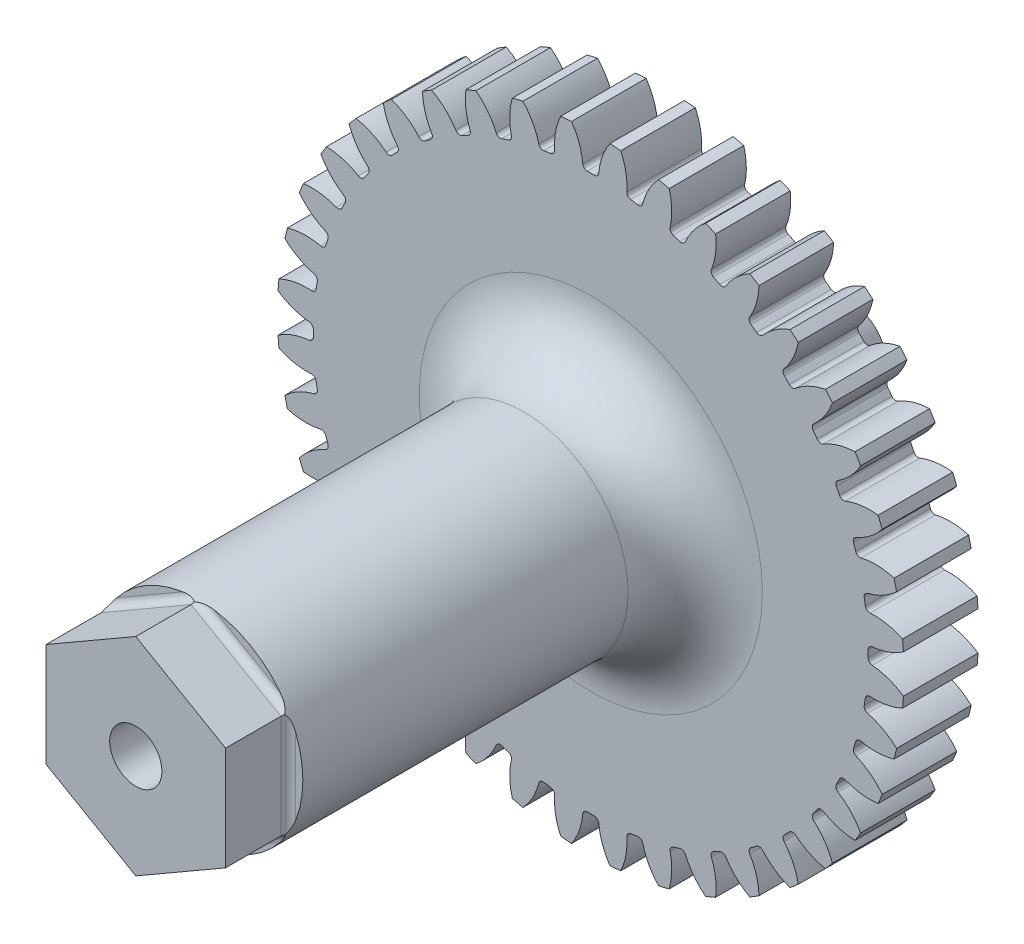
from build123d import *

# Parameters (mm, degrees)
SKETCH1_R                = 21
BOSS_EXTRUDE1_DEPTH      = 2.5
CUT_EXTRUDE1_DEPTH       = 31.116440693
FILLET1_R                = 0.3
CIRPATTERN1_COUNT        = 40
FILLET1_OF_CIRPATTERN1_R = 0.3
SKETCH4_R                = 7
WHEELSHAFT_DEPTH         = 26.3
SKETCH5_R                = 2.8
BOSS_EXTRUDE3_DEPTH      = 12.43
FILLET3_R                = 7.4
CHAMFER1_SIZE            = 1.5
CHAMFER1_SIZE2           = 0.401923789
FILLET4_R                = 4.5
BOSS_EXTRUDE4_DEPTH      = 4.2
SKETCH7_R                = 1.75
CUT_EXTRUDE2_DEPTH       = 7
FILLET5_R                = 0.5


with BuildPart() as part:
    # Sketch1 → Boss-Extrude1 (new, symmetric)
    with BuildSketch(Plane.XY):
        Circle(SKETCH1_R)
    extrude(amount=BOSS_EXTRUDE1_DEPTH, both=True)

    # Sketch3 → Cut-Extrude1 (cut, symmetric)
    with BuildSketch(Plane.XY.offset(2.5)):
        with BuildLine():
            ThreePointArc((-2.139593078, 21.895710572), (-0.970695217, 20.420263648), (-0.519675362, 18.592738839))
            ThreePointArc((-0.519675362, 18.592738839), (0, 18.6), (0.519675362, 18.592738839))
            ThreePointArc((0.519675362, 18.592738839), (0.970695217, 20.420263648), (2.139593078, 21.895710572))
            ThreePointArc((2.139593078, 21.895710572), (0, 22), (-2.139593078, 21.895710572))
        make_face()
    cut_extrude1 = extrude(amount=CUT_EXTRUDE1_DEPTH, both=True, mode=Mode.SUBTRACT)

    # Fillet1
    fillet1_edges = [part.edges().sort_by_distance(p)[0] for p in [
        (-0.519675362, 18.592738839, 0),
        (0.519675362, 18.592738839, 0),
    ]]
    fillet(fillet1_edges, radius=FILLET1_R)

    # CirPattern1: Cut-Extrude1 ×40 about axis
    cirpattern1_axis = Axis((0, 0, 0), (0, 0, 1))
    for i in range(1, CIRPATTERN1_COUNT):
        add(cut_extrude1.rotate(cirpattern1_axis, i * 360 / CIRPATTERN1_COUNT), mode=Mode.SUBTRACT)

    # Fillet1 of CirPattern1
    fillet1_of_cirpattern1_edges = [part.edges().sort_by_distance(p)[0] for p in [
        (-3.42182245, 18.282536233, 0),
        (-2.395267858, 18.445126508, 0),
        (-6.239712913, 17.52215691, 0),
        (-5.251231633, 17.843333947, 0),
        (-8.903960935, 16.33032393, 0),
        (-7.977892658, 16.802179285, 0),
        (-11.348963889, 14.736384178, 0),
        (-10.508111489, 15.347299206, 0),
        (-13.514517686, 12.779585741, 0),
        (-12.779585741, 13.514517686, 0),
        (-15.347299206, 10.508111489, 0),
        (-14.736384178, 11.348963889, 0),
        (-16.802179285, 7.977892658, 0),
        (-16.33032393, 8.903960935, 0),
        (-17.843333947, 5.251231633, 0),
        (-17.52215691, 6.239712913, 0),
        (-18.445126508, 2.395267858, 0),
        (-18.282536233, 3.42182245, 0),
        (-18.592738839, -0.519675362, 0),
        (-18.592738839, 0.519675362, 0),
        (-18.282536233, -3.42182245, 0),
        (-18.445126508, -2.395267858, 0),
        (-17.52215691, -6.239712913, 0),
        (-17.843333947, -5.251231633, 0),
        (-16.33032393, -8.903960935, 0),
        (-16.802179285, -7.977892658, 0),
        (-14.736384178, -11.348963889, 0),
        (-15.347299206, -10.508111489, 0),
        (-12.779585741, -13.514517686, 0),
        (-13.514517686, -12.779585741, 0),
        (-10.508111489, -15.347299206, 0),
        (-11.348963889, -14.736384178, 0),
        (-7.977892658, -16.802179285, 0),
        (-8.903960935, -16.33032393, 0),
        (-5.251231633, -17.843333947, 0),
        (-6.239712913, -17.52215691, 0),
        (-2.395267858, -18.445126508, 0),
        (-3.42182245, -18.282536233, 0),
        (0.519675362, -18.592738839, 0),
        (-0.519675362, -18.592738839, 0),
        (3.42182245, -18.282536233, 0),
        (2.395267858, -18.445126508, 0),
        (6.239712913, -17.52215691, 0),
        (5.251231633, -17.843333947, 0),
        (8.903960935, -16.33032393, 0),
        (7.977892658, -16.802179285, 0),
        (11.348963889, -14.736384178, 0),
        (10.508111489, -15.347299206, 0),
        (13.514517686, -12.779585741, 0),
        (12.779585741, -13.514517686, 0),
        (15.347299206, -10.508111489, 0),
        (14.736384178, -11.348963889, 0),
        (16.802179285, -7.977892658, 0),
        (16.33032393, -8.903960935, 0),
        (17.843333947, -5.251231633, 0),
        (17.52215691, -6.239712913, 0),
        (18.445126508, -2.395267858, 0),
        (18.282536233, -3.42182245, 0),
        (18.592738839, 0.519675362, 0),
        (18.592738839, -0.519675362, 0),
        (18.282536233, 3.42182245, 0),
        (18.445126508, 2.395267858, 0),
        (17.52215691, 6.239712913, 0),
        (17.843333947, 5.251231633, 0),
        (16.33032393, 8.903960935, 0),
        (16.802179285, 7.977892658, 0),
        (14.736384178, 11.348963889, 0),
        (15.347299206, 10.508111489, 0),
        (12.779585741, 13.514517686, 0),
        (13.514517686, 12.779585741, 0),
        (10.508111489, 15.347299206, 0),
        (11.348963889, 14.736384178, 0),
        (7.977892658, 16.802179285, 0),
        (8.903960935, 16.33032393, 0),
        (5.251231633, 17.843333947, 0),
        (6.239712913, 17.52215691, 0),
        (2.395267858, 18.445126508, 0),
        (3.42182245, 18.282536233, 0),
    ]]
    fillet(fillet1_of_cirpattern1_edges, radius=FILLET1_OF_CIRPATTERN1_R)

    # Sketch4 → Wheelshaft (add)
    with BuildSketch(Plane.XY.offset(2.5)):
        Circle(SKETCH4_R)
    extrude(amount=WHEELSHAFT_DEPTH)

    # Sketch5 → Boss-Extrude3 (add)
    with BuildSketch(Plane(origin=(0, 0, -2.5), x_dir=(-1, 0, 0), z_dir=(0, 0, -1))):
        with Locations(Location((0, 0, 0), (0, 0, 180))):
            Circle(SKETCH5_R)
    extrude(amount=BOSS_EXTRUDE3_DEPTH)

    # Fillet3
    fillet3_edges = [part.edges().sort_by_distance(p)[0] for p in [
        (-2.8, 0, -2.5),
    ]]
    fillet(fillet3_edges, radius=FILLET3_R)

    # Chamfer1
    chamfer1_edges = [part.edges().sort_by_distance(p)[0] for p in [
        (-2.8, 0, -14.93),
    ]]
    chamfer1_side = [part.faces().sort_by_distance(p)[0] for p in [
        (-2.8, 0, -12.415),
    ]]
    chamfer(chamfer1_edges, length=CHAMFER1_SIZE, length2=CHAMFER1_SIZE2, reference=chamfer1_side[0])

    # Fillet4
    fillet4_edges = [part.edges().sort_by_distance(p)[0] for p in [
        (-7, 0, 2.5),
    ]]
    fillet(fillet4_edges, radius=FILLET4_R)

    # Sketch6 → Boss-Extrude4 (add)
    with BuildSketch(Plane.XY.offset(28.8)):
        Polygon((0, 6.95), (-6.018876556, 3.475), (-6.018876556, -3.475), (0, -6.95), (6.018876556, -3.475), (6.018876556, 3.475), align=None)
    extrude(amount=BOSS_EXTRUDE4_DEPTH)

    # Sketch7 → Cut-Extrude2 (cut)
    with BuildSketch(Plane.XY.offset(33)):
        Circle(SKETCH7_R)
    extrude(amount=-CUT_EXTRUDE2_DEPTH, mode=Mode.SUBTRACT)

    # Fillet5
    # the kernel refuses this fillet: 0.5 mm, written as the material it adds along each edge
    with BuildSketch(Plane(origin=(7.101408311, 2.85, 28.8), x_dir=(0.4999999999999999, 0.8660254037844388, 0), z_dir=(-0.8660254037844387, 0.49999999999999983, 0))) as fillet5_piece_1_section:
        with BuildLine():
            CenterArc((FILLET5_R, -FILLET5_R), FILLET5_R, 90, 90)
            Line((0, -FILLET5_R), (0, 0))
            Line((0, 0), (FILLET5_R, 0))
        make_face()
    fillet5_piece_1 = extrude(amount=9.45, mode=Mode.PRIVATE)
    fillet5_piece_1 = fillet5_piece_1 & Plane(origin=(0, 0, 28.916287623), x_dir=(1, 0, 0), z_dir=(0, 0, -1)) * Cylinder(7, 21, mode=Mode.PRIVATE)
    fillet5_piece_1 = split(fillet5_piece_1, bisect_by=Plane(origin=(1.585318022, 7.865283786, 28.916287623), z_dir=(0.4999999999999999, -0.8660254037844387, 0)), keep=Keep.TOP, mode=Mode.PRIVATE)
    fillet5_piece_1 = split(fillet5_piece_1, bisect_by=Plane(origin=(6.018876556, 5.305567502, 28.916287623), z_dir=(-1, 0, 0)), keep=Keep.TOP, mode=Mode.PRIVATE)
    add(fillet5_piece_1)
    with BuildSketch(Plane(origin=(1.082531755, 7.575, 28.8), x_dir=(-0.49999999999999994, 0.8660254037844388, 0), z_dir=(-0.8660254037844387, -0.4999999999999999, 0))) as fillet5_piece_2_section:
        with BuildLine():
            CenterArc((FILLET5_R, -FILLET5_R), FILLET5_R, 90, 90)
            Line((0, -FILLET5_R), (0, 0))
            Line((0, 0), (FILLET5_R, 0))
        make_face()
    fillet5_piece_2 = extrude(amount=9.45, mode=Mode.PRIVATE)
    fillet5_piece_2 = fillet5_piece_2 & Plane(origin=(0, 0, 28.916287623), x_dir=(1, 0, 0), z_dir=(0, 0, -1)) * Cylinder(7, 21, mode=Mode.PRIVATE)
    fillet5_piece_2 = split(fillet5_piece_2, bisect_by=Plane(origin=(-1.58531796, 7.865283751, 28.916287623), z_dir=(-0.49999999999999994, -0.8660254037844389, 0)), keep=Keep.TOP, mode=Mode.PRIVATE)
    fillet5_piece_2 = split(fillet5_piece_2, bisect_by=Plane(origin=(-6.018876556, 5.305567573, 28.916287623), z_dir=(1, 0, 0)), keep=Keep.TOP, mode=Mode.PRIVATE)
    add(fillet5_piece_2)
    with BuildSketch(Plane(origin=(-6.018876556, 4.725, 28.8), x_dir=(-1, 0, 0), z_dir=(0, -1, 0))) as fillet5_piece_3_section:
        with BuildLine():
            CenterArc((FILLET5_R, -FILLET5_R), FILLET5_R, 90, 90)
            Line((0, -FILLET5_R), (0, 0))
            Line((0, 0), (FILLET5_R, 0))
        make_face()
    fillet5_piece_3 = extrude(amount=9.45, mode=Mode.PRIVATE)
    fillet5_piece_3 = fillet5_piece_3 & Plane(origin=(0, 0, 28.916287623), x_dir=(1, 0, 0), z_dir=(0, 0, -1)) * Cylinder(7, 21, mode=Mode.PRIVATE)
    fillet5_piece_3 = split(fillet5_piece_3, bisect_by=Plane(origin=(-7.604194524, 2.559716244, 28.916287623), z_dir=(0.4999999999999999, -0.8660254037844387, 0)), keep=Keep.TOP, mode=Mode.PRIVATE)
    fillet5_piece_3 = split(fillet5_piece_3, bisect_by=Plane(origin=(-7.604194572, -2.559716217, 28.916287623), z_dir=(0.5000000000000001, 0.8660254037844386, 0)), keep=Keep.TOP, mode=Mode.PRIVATE)
    add(fillet5_piece_3)
    with BuildSketch(Plane(origin=(-7.101408311, -2.85, 28.8), x_dir=(-0.5000000000000001, -0.8660254037844386, 0), z_dir=(0.8660254037844386, -0.5000000000000001, 0))) as fillet5_piece_4_section:
        with BuildLine():
            CenterArc((FILLET5_R, -FILLET5_R), FILLET5_R, 90, 90)
            Line((0, -FILLET5_R), (0, 0))
            Line((0, 0), (FILLET5_R, 0))
        make_face()
    fillet5_piece_4 = extrude(amount=9.45, mode=Mode.PRIVATE)
    fillet5_piece_4 = fillet5_piece_4 & Plane(origin=(0, 0, 28.916287623), x_dir=(1, 0, 0), z_dir=(0, 0, -1)) * Cylinder(7, 21, mode=Mode.PRIVATE)
    fillet5_piece_4 = split(fillet5_piece_4, bisect_by=Plane(origin=(-6.018876556, -5.305567511, 28.916287623), z_dir=(1, 0, 0)), keep=Keep.TOP, mode=Mode.PRIVATE)
    fillet5_piece_4 = split(fillet5_piece_4, bisect_by=Plane(origin=(-1.585318015, -7.865283783, 28.916287623), z_dir=(-0.49999999999999994, 0.8660254037844387, 0)), keep=Keep.TOP, mode=Mode.PRIVATE)
    add(fillet5_piece_4)
    with BuildSketch(Plane(origin=(-1.082531755, -7.575, 28.8), x_dir=(0.49999999999999994, -0.8660254037844387, 0), z_dir=(0.8660254037844387, 0.49999999999999994, 0))) as fillet5_piece_5_section:
        with BuildLine():
            CenterArc((FILLET5_R, -FILLET5_R), FILLET5_R, 90, 90)
            Line((0, -FILLET5_R), (0, 0))
            Line((0, 0), (FILLET5_R, 0))
        make_face()
    fillet5_piece_5 = extrude(amount=9.45, mode=Mode.PRIVATE)
    fillet5_piece_5 = fillet5_piece_5 & Plane(origin=(0, 0, 28.916287623), x_dir=(1, 0, 0), z_dir=(0, 0, -1)) * Cylinder(7, 21, mode=Mode.PRIVATE)
    fillet5_piece_5 = split(fillet5_piece_5, bisect_by=Plane(origin=(1.585317968, -7.865283756, 28.916287623), z_dir=(0.5000000000000001, 0.8660254037844386, 0)), keep=Keep.TOP, mode=Mode.PRIVATE)
    fillet5_piece_5 = split(fillet5_piece_5, bisect_by=Plane(origin=(6.018876556, -5.305567566, 28.916287623), z_dir=(-1, 0, 0)), keep=Keep.TOP, mode=Mode.PRIVATE)
    add(fillet5_piece_5)
    with BuildSketch(Plane(origin=(6.018876556, -4.725, 28.8), x_dir=(1, 0, 0), z_dir=(0, 1, 0))) as fillet5_piece_6_section:
        with BuildLine():
            CenterArc((FILLET5_R, -FILLET5_R), FILLET5_R, 90, 90)
            Line((0, -FILLET5_R), (0, 0))
            Line((0, 0), (FILLET5_R, 0))
        make_face()
    fillet5_piece_6 = extrude(amount=9.45, mode=Mode.PRIVATE)
    fillet5_piece_6 = fillet5_piece_6 & Plane(origin=(0, 0, 28.916287623), x_dir=(1, 0, 0), z_dir=(0, 0, -1)) * Cylinder(7, 21, mode=Mode.PRIVATE)
    fillet5_piece_6 = split(fillet5_piece_6, bisect_by=Plane(origin=(7.604194516, -2.559716249, 28.916287623), z_dir=(-0.49999999999999994, 0.8660254037844387, 0)), keep=Keep.TOP, mode=Mode.PRIVATE)
    fillet5_piece_6 = split(fillet5_piece_6, bisect_by=Plane(origin=(7.604194578, 2.559716214, 28.916287623), z_dir=(-0.49999999999999994, -0.8660254037844389, 0)), keep=Keep.TOP, mode=Mode.PRIVATE)
    add(fillet5_piece_6)
    with BuildSketch(Plane(origin=(6.018876556, -4.725, 28.8), x_dir=(1, 0, 0), z_dir=(0, 1, 0))) as fillet5_piece_7a_section:
        with BuildLine():
            CenterArc((FILLET5_R, -FILLET5_R), FILLET5_R, 90, 90)
            Line((0, -FILLET5_R), (0, 0))
            Line((0, 0), (FILLET5_R, 0))
        make_face()
    fillet5_piece_7a = extrude(amount=9.45, mode=Mode.PRIVATE)
    fillet5_piece_7a = fillet5_piece_7a & Plane(origin=(0, 0, 28.991965951), x_dir=(1, 0, 0), z_dir=(0, 0, -1)) * Cylinder(7, 21, mode=Mode.PRIVATE)
    fillet5_piece_7a = split(fillet5_piece_7a, bisect_by=Plane(origin=(6.019214264, 3.474805024, 28.991965951), z_dir=(0.49999999999999994, 0.8660254037844389, 0)), keep=Keep.TOP, mode=Mode.PRIVATE)
    with BuildSketch(Plane(origin=(7.101408311, 2.85, 28.8), x_dir=(0.4999999999999999, 0.8660254037844388, 0), z_dir=(-0.8660254037844387, 0.49999999999999983, 0))) as fillet5_piece_7b_section:
        with BuildLine():
            CenterArc((FILLET5_R, -FILLET5_R), FILLET5_R, 90, 90)
            Line((0, -FILLET5_R), (0, 0))
            Line((0, 0), (FILLET5_R, 0))
        make_face()
    fillet5_piece_7b = extrude(amount=9.45, mode=Mode.PRIVATE)
    fillet5_piece_7b = fillet5_piece_7b & Plane(origin=(0, 0, 28.991965951), x_dir=(1, 0, 0), z_dir=(0, 0, -1)) * Cylinder(7, 21, mode=Mode.PRIVATE)
    fillet5_piece_7b = split(fillet5_piece_7b, bisect_by=Plane(origin=(6.018876556, 3.475389952, 28.991965951), z_dir=(1, 0, 0)), keep=Keep.TOP, mode=Mode.PRIVATE)
    fillet5_piece_7 = fillet5_piece_7a & fillet5_piece_7b
    add(fillet5_piece_7)
    with BuildSketch(Plane(origin=(1.082531755, 7.575, 28.8), x_dir=(-0.49999999999999994, 0.8660254037844388, 0), z_dir=(-0.8660254037844387, -0.4999999999999999, 0))) as fillet5_piece_8a_section:
        with BuildLine():
            CenterArc((FILLET5_R, -FILLET5_R), FILLET5_R, 90, 90)
            Line((0, -FILLET5_R), (0, 0))
            Line((0, 0), (FILLET5_R, 0))
        make_face()
    fillet5_piece_8a = extrude(amount=9.45, mode=Mode.PRIVATE)
    fillet5_piece_8a = fillet5_piece_8a & Plane(origin=(0, 0, 28.991965951), x_dir=(1, 0, 0), z_dir=(0, 0, -1)) * Cylinder(7, 21, mode=Mode.PRIVATE)
    fillet5_piece_8a = split(fillet5_piece_8a, bisect_by=Plane(origin=(-0.000337708, 6.950194976, 28.991965951), z_dir=(0.49999999999999994, 0.8660254037844389, 0)), keep=Keep.TOP, mode=Mode.PRIVATE)
    with BuildSketch(Plane(origin=(7.101408311, 2.85, 28.8), x_dir=(0.4999999999999999, 0.8660254037844388, 0), z_dir=(-0.8660254037844387, 0.49999999999999983, 0))) as fillet5_piece_8b_section:
        with BuildLine():
            CenterArc((FILLET5_R, -FILLET5_R), FILLET5_R, 90, 90)
            Line((0, -FILLET5_R), (0, 0))
            Line((0, 0), (FILLET5_R, 0))
        make_face()
    fillet5_piece_8b = extrude(amount=9.45, mode=Mode.PRIVATE)
    fillet5_piece_8b = fillet5_piece_8b & Plane(origin=(0, 0, 28.991965951), x_dir=(1, 0, 0), z_dir=(0, 0, -1)) * Cylinder(7, 21, mode=Mode.PRIVATE)
    fillet5_piece_8b = split(fillet5_piece_8b, bisect_by=Plane(origin=(0.000337708, 6.950194976, 28.991965951), z_dir=(-0.4999999999999999, 0.8660254037844387, 0)), keep=Keep.TOP, mode=Mode.PRIVATE)
    fillet5_piece_8 = fillet5_piece_8a & fillet5_piece_8b
    add(fillet5_piece_8)
    with BuildSketch(Plane(origin=(1.082531755, 7.575, 28.8), x_dir=(-0.49999999999999994, 0.8660254037844388, 0), z_dir=(-0.8660254037844387, -0.4999999999999999, 0))) as fillet5_piece_9a_section:
        with BuildLine():
            CenterArc((FILLET5_R, -FILLET5_R), FILLET5_R, 90, 90)
            Line((0, -FILLET5_R), (0, 0))
            Line((0, 0), (FILLET5_R, 0))
        make_face()
    fillet5_piece_9a = extrude(amount=9.45, mode=Mode.PRIVATE)
    fillet5_piece_9a = fillet5_piece_9a & Plane(origin=(0, 0, 28.991965951), x_dir=(1, 0, 0), z_dir=(0, 0, -1)) * Cylinder(7, 21, mode=Mode.PRIVATE)
    fillet5_piece_9a = split(fillet5_piece_9a, bisect_by=Plane(origin=(-6.018876556, 3.475389952, 28.991965951), z_dir=(-1, 0, 0)), keep=Keep.TOP, mode=Mode.PRIVATE)
    with BuildSketch(Plane(origin=(-6.018876556, 4.725, 28.8), x_dir=(-1, 0, 0), z_dir=(0, -1, 0))) as fillet5_piece_9b_section:
        with BuildLine():
            CenterArc((FILLET5_R, -FILLET5_R), FILLET5_R, 90, 90)
            Line((0, -FILLET5_R), (0, 0))
            Line((0, 0), (FILLET5_R, 0))
        make_face()
    fillet5_piece_9b = extrude(amount=9.45, mode=Mode.PRIVATE)
    fillet5_piece_9b = fillet5_piece_9b & Plane(origin=(0, 0, 28.991965947), x_dir=(1, 0, 0), z_dir=(0, 0, -1)) * Cylinder(7, 21, mode=Mode.PRIVATE)
    fillet5_piece_9b = split(fillet5_piece_9b, bisect_by=Plane(origin=(-6.019214267, 3.474805023, 28.991965947), z_dir=(-0.4999999999999999, 0.8660254037844387, 0)), keep=Keep.TOP, mode=Mode.PRIVATE)
    fillet5_piece_9 = fillet5_piece_9a & fillet5_piece_9b
    add(fillet5_piece_9)
    with BuildSketch(Plane(origin=(-6.018876556, 4.725, 28.8), x_dir=(-1, 0, 0), z_dir=(0, -1, 0))) as fillet5_piece_10a_section:
        with BuildLine():
            CenterArc((FILLET5_R, -FILLET5_R), FILLET5_R, 90, 90)
            Line((0, -FILLET5_R), (0, 0))
            Line((0, 0), (FILLET5_R, 0))
        make_face()
    fillet5_piece_10a = extrude(amount=9.45, mode=Mode.PRIVATE)
    fillet5_piece_10a = fillet5_piece_10a & Plane(origin=(0, 0, 28.991965957), x_dir=(1, 0, 0), z_dir=(0, 0, -1)) * Cylinder(7, 21, mode=Mode.PRIVATE)
    fillet5_piece_10a = split(fillet5_piece_10a, bisect_by=Plane(origin=(-6.019214268, -3.474805022, 28.991965957), z_dir=(-0.5000000000000001, -0.8660254037844386, 0)), keep=Keep.TOP, mode=Mode.PRIVATE)
    with BuildSketch(Plane(origin=(-7.101408311, -2.85, 28.8), x_dir=(-0.5000000000000001, -0.8660254037844386, 0), z_dir=(0.8660254037844386, -0.5000000000000001, 0))) as fillet5_piece_10b_section:
        with BuildLine():
            CenterArc((FILLET5_R, -FILLET5_R), FILLET5_R, 90, 90)
            Line((0, -FILLET5_R), (0, 0))
            Line((0, 0), (FILLET5_R, 0))
        make_face()
    fillet5_piece_10b = extrude(amount=9.45, mode=Mode.PRIVATE)
    fillet5_piece_10b = fillet5_piece_10b & Plane(origin=(0, 0, 28.991965947), x_dir=(1, 0, 0), z_dir=(0, 0, -1)) * Cylinder(7, 21, mode=Mode.PRIVATE)
    fillet5_piece_10b = split(fillet5_piece_10b, bisect_by=Plane(origin=(-6.018876556, -3.475389955, 28.991965947), z_dir=(-1, 0, 0)), keep=Keep.TOP, mode=Mode.PRIVATE)
    fillet5_piece_10 = fillet5_piece_10a & fillet5_piece_10b
    add(fillet5_piece_10)
    with BuildSketch(Plane(origin=(-7.101408311, -2.85, 28.8), x_dir=(-0.5000000000000001, -0.8660254037844386, 0), z_dir=(0.8660254037844386, -0.5000000000000001, 0))) as fillet5_piece_11a_section:
        with BuildLine():
            CenterArc((FILLET5_R, -FILLET5_R), FILLET5_R, 90, 90)
            Line((0, -FILLET5_R), (0, 0))
            Line((0, 0), (FILLET5_R, 0))
        make_face()
    fillet5_piece_11a = extrude(amount=9.45, mode=Mode.PRIVATE)
    fillet5_piece_11a = fillet5_piece_11a & Plane(origin=(0, 0, 28.991965957), x_dir=(1, 0, 0), z_dir=(0, 0, -1)) * Cylinder(7, 21, mode=Mode.PRIVATE)
    fillet5_piece_11a = split(fillet5_piece_11a, bisect_by=Plane(origin=(-0.000337712, -6.950194978, 28.991965957), z_dir=(0.49999999999999994, -0.8660254037844387, 0)), keep=Keep.TOP, mode=Mode.PRIVATE)
    with BuildSketch(Plane(origin=(-1.082531755, -7.575, 28.8), x_dir=(0.49999999999999994, -0.8660254037844387, 0), z_dir=(0.8660254037844387, 0.49999999999999994, 0))) as fillet5_piece_11b_section:
        with BuildLine():
            CenterArc((FILLET5_R, -FILLET5_R), FILLET5_R, 90, 90)
            Line((0, -FILLET5_R), (0, 0))
            Line((0, 0), (FILLET5_R, 0))
        make_face()
    fillet5_piece_11b = extrude(amount=9.45, mode=Mode.PRIVATE)
    fillet5_piece_11b = fillet5_piece_11b & Plane(origin=(0, 0, 28.991965947), x_dir=(1, 0, 0), z_dir=(0, 0, -1)) * Cylinder(7, 21, mode=Mode.PRIVATE)
    fillet5_piece_11b = split(fillet5_piece_11b, bisect_by=Plane(origin=(0.000337711, -6.950194977, 28.991965947), z_dir=(-0.5000000000000001, -0.8660254037844386, 0)), keep=Keep.TOP, mode=Mode.PRIVATE)
    fillet5_piece_11 = fillet5_piece_11a & fillet5_piece_11b
    add(fillet5_piece_11)
    with BuildSketch(Plane(origin=(-1.082531755, -7.575, 28.8), x_dir=(0.49999999999999994, -0.8660254037844387, 0), z_dir=(0.8660254037844387, 0.49999999999999994, 0))) as fillet5_piece_12a_section:
        with BuildLine():
            CenterArc((FILLET5_R, -FILLET5_R), FILLET5_R, 90, 90)
            Line((0, -FILLET5_R), (0, 0))
            Line((0, 0), (FILLET5_R, 0))
        make_face()
    fillet5_piece_12a = extrude(amount=9.45, mode=Mode.PRIVATE)
    fillet5_piece_12a = fillet5_piece_12a & Plane(origin=(0, 0, 28.991965957), x_dir=(1, 0, 0), z_dir=(0, 0, -1)) * Cylinder(7, 21, mode=Mode.PRIVATE)
    fillet5_piece_12a = split(fillet5_piece_12a, bisect_by=Plane(origin=(6.018876556, -3.475389956, 28.991965957), z_dir=(1, 0, 0)), keep=Keep.TOP, mode=Mode.PRIVATE)
    with BuildSketch(Plane(origin=(6.018876556, -4.725, 28.8), x_dir=(1, 0, 0), z_dir=(0, 1, 0))) as fillet5_piece_12b_section:
        with BuildLine():
            CenterArc((FILLET5_R, -FILLET5_R), FILLET5_R, 90, 90)
            Line((0, -FILLET5_R), (0, 0))
            Line((0, 0), (FILLET5_R, 0))
        make_face()
    fillet5_piece_12b = extrude(amount=9.45, mode=Mode.PRIVATE)
    fillet5_piece_12b = fillet5_piece_12b & Plane(origin=(0, 0, 28.991965951), x_dir=(1, 0, 0), z_dir=(0, 0, -1)) * Cylinder(7, 21, mode=Mode.PRIVATE)
    fillet5_piece_12b = split(fillet5_piece_12b, bisect_by=Plane(origin=(6.019214264, -3.474805024, 28.991965951), z_dir=(0.49999999999999994, -0.8660254037844387, 0)), keep=Keep.TOP, mode=Mode.PRIVATE)
    fillet5_piece_12 = fillet5_piece_12a & fillet5_piece_12b
    add(fillet5_piece_12)


solid = part.part
